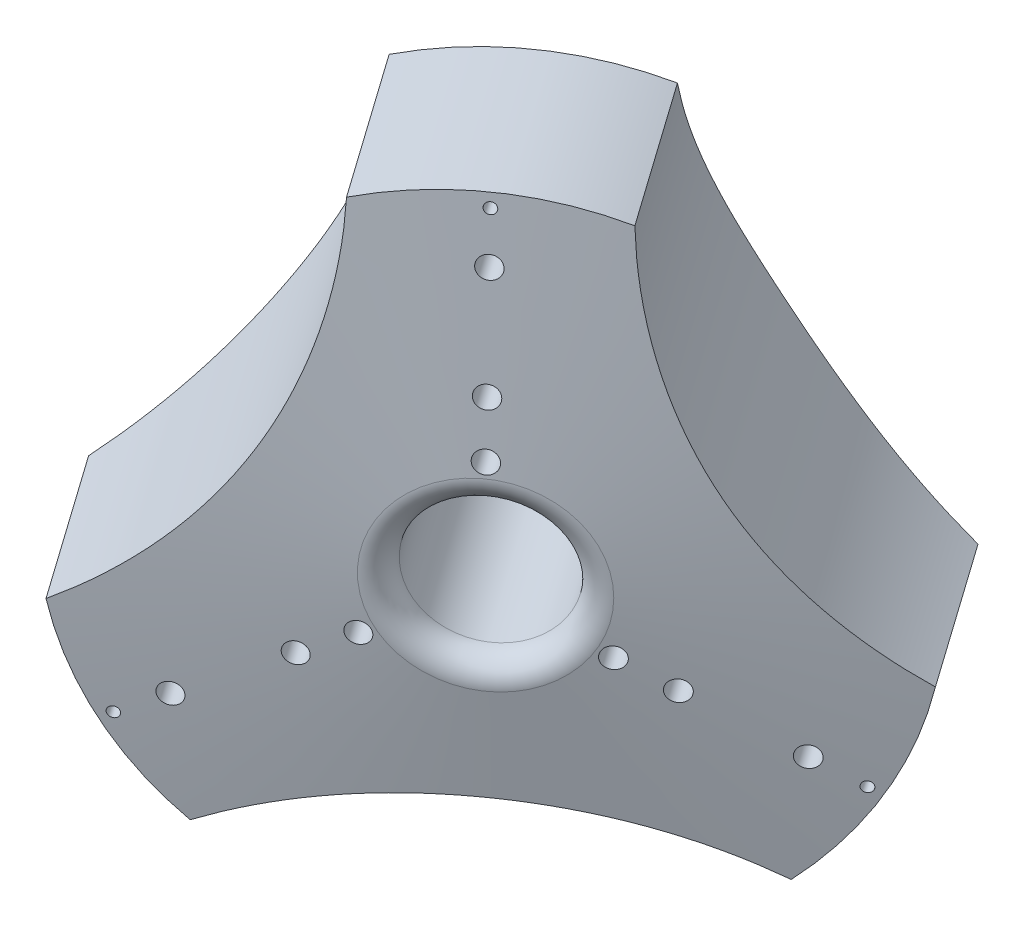
from build123d import *
from build123d.topology import SkipClean

# Parameters (mm, degrees)
CUT_EXTRUDE_START         = -62.125059625
CUT_EXTRUDE_1_OUTLINE_R   = 2
CUT_EXTRUDE_1_OUTLINE_R_2 = 1
CUT_EXTRUDE_1_OUTLINE_R_3 = 12.5
CUT_EXTRUDE_1_OUTLINE_R_4 = 10
CUT_EXTRUDE_1_DEPTH       = 62.125059625
FILLET_1_R                = 4.5
SHELL_1_T                 = 2
SKETCH_3_W                = 51.087463651
SKETCH_3_H                = 2.461244994
SKETCH_3_W_2              = 34.457429911
SKETCH_3_H_2              = 2.860365803
EXTRUDE_1_DEPTH           = 0.5
PATTERN_CIRCULAR_1_COUNT  = 3


# Read off the part's stored shape, not the designer's step: 旋转1, 切除-拉伸1
with BuildPart() as part:
    # 旋转1 outline → 旋转1 (revolve)
    with BuildSketch(Plane(origin=(99.94130942, 0, -70.573719517), x_dir=(0.8168642149223474, 0, -0.5768300047494903), z_dir=(0, -1, 0))):
        Polygon((10, 10.279561824), (10, -51.8454977), (61.61960751, -28.02437299), (61.61960751, 5.556476213), align=None)
    revolve(axis=Axis((99.94130942, 0, -70.573719517), (0.5768300047494903, 0, 0.8168642149223474)))

    # 切除-拉伸1 outline → 切除-拉伸1 (cut)
    # profile 1 of 16: a face of its own
    with BuildSketch(Plane(origin=(5.929559696, 0, 8.397006199), x_dir=(0.8168642149223475, 0, -0.5768300047494903), z_dir=(0.5768300047494903, 0, 0.8168642149223475)).offset(CUT_EXTRUDE_START)):
        with BuildLine():
            ThreePointArc((102.772124807, 58.427562009), (68.983372836, 30.809803909), (61.960068463, -12.26099267))
            ThreePointArc((61.960068463, -12.26099267), (91.170603939, 18.000000439), (102.772124807, 58.427562009))
        make_face()
    # profile 2 of 16: a face of its own
    with BuildSketch(Plane(origin=(5.929559696, 0, 8.397006199), x_dir=(0.8168642149223475, 0, -0.5768300047494903), z_dir=(0.5768300047494903, 0, 0.8168642149223475)).offset(CUT_EXTRUDE_START)):
        with BuildLine():
            ThreePointArc((163.159576322, -46.166570338), (122.34751937, -36), (81.535462149, -46.166569261))
            ThreePointArc((81.535462149, -46.166569261), (122.347518625, -61.61960751), (163.159576322, -46.166570338))
        make_face()
    # profile 3 of 16: a face of its own
    with BuildSketch(Plane(origin=(5.929559696, 0, 8.397006199), x_dir=(0.8168642149223475, 0, -0.5768300047494903), z_dir=(0.5768300047494903, 0, 0.8168642149223475)).offset(CUT_EXTRUDE_START)):
        with BuildLine():
            ThreePointArc((182.734967981, -12.26099267), (175.711663697, 30.809803755), (141.922911974, 58.427561896))
            ThreePointArc((141.922911974, 58.427561896), (153.524432758, 18), (182.734967981, -12.26099267))
        make_face()
    # profile 4 of 16: a face of its own
    with BuildSketch(Plane(origin=(5.929559696, 0, 8.397006199), x_dir=(0.8168642149223475, 0, -0.5768300047494903), z_dir=(0.5768300047494903, 0, 0.8168642149223475)).offset(CUT_EXTRUDE_START)):
        with Locations((122.347518222, 50)):
            Circle(CUT_EXTRUDE_1_OUTLINE_R)
    # profile 5 of 16: a face of its own
    with BuildSketch(Plane(origin=(5.929559696, 0, 8.397006199), x_dir=(0.8168642149223475, 0, -0.5768300047494903), z_dir=(0.5768300047494903, 0, 0.8168642149223475)).offset(CUT_EXTRUDE_START)):
        with Locations((71.148436256, -29.559803755)):
            Circle(CUT_EXTRUDE_1_OUTLINE_R_2)
    # profile 6 of 16: a face of its own
    with BuildSketch(Plane(origin=(5.929559696, 0, 8.397006199), x_dir=(0.8168642149223475, 0, -0.5768300047494903), z_dir=(0.5768300047494903, 0, 0.8168642149223475)).offset(CUT_EXTRUDE_START)):
        with Locations((79.046248032, -25)):
            Circle(CUT_EXTRUDE_1_OUTLINE_R)
    # profile 7 of 16: a face of its own
    with BuildSketch(Plane(origin=(5.929559696, 0, 8.397006199), x_dir=(0.8168642149223475, 0, -0.5768300047494903), z_dir=(0.5768300047494903, 0, 0.8168642149223475)).offset(CUT_EXTRUDE_START)):
        with Locations((96.366756108, -15)):
            Circle(CUT_EXTRUDE_1_OUTLINE_R)
    # profile 8 of 16: a face of its own
    with BuildSketch(Plane(origin=(5.929559696, 0, 8.397006199), x_dir=(0.8168642149223475, 0, -0.5768300047494903), z_dir=(0.5768300047494903, 0, 0.8168642149223475)).offset(CUT_EXTRUDE_START)):
        with Locations((122.347518222, 30)):
            Circle(CUT_EXTRUDE_1_OUTLINE_R)
    # profile 9 of 16: a face of its own
    with BuildSketch(Plane(origin=(5.929559696, 0, 8.397006199), x_dir=(0.8168642149223475, 0, -0.5768300047494903), z_dir=(0.5768300047494903, 0, 0.8168642149223475)).offset(CUT_EXTRUDE_START)):
        with Locations((122.347518222, 20)):
            Circle(CUT_EXTRUDE_1_OUTLINE_R)
    # profile 10 of 16: a face of its own
    with BuildSketch(Plane(origin=(5.929559696, 0, 8.397006199), x_dir=(0.8168642149223475, 0, -0.5768300047494903), z_dir=(0.5768300047494903, 0, 0.8168642149223475)).offset(CUT_EXTRUDE_START)):
        with Locations((122.347518222, 59.11960751)):
            Circle(CUT_EXTRUDE_1_OUTLINE_R_2)
    # profile 11 of 16: a face of its own
    with BuildSketch(Plane(origin=(5.929559696, 0, 8.397006199), x_dir=(0.8168642149223475, 0, -0.5768300047494903), z_dir=(0.5768300047494903, 0, 0.8168642149223475)).offset(CUT_EXTRUDE_START)):
        with Locations((173.546600187, -29.559803755)):
            Circle(CUT_EXTRUDE_1_OUTLINE_R_2)
    # profile 12 of 16: a face of its own
    with BuildSketch(Plane(origin=(5.929559696, 0, 8.397006199), x_dir=(0.8168642149223475, 0, -0.5768300047494903), z_dir=(0.5768300047494903, 0, 0.8168642149223475)).offset(CUT_EXTRUDE_START)):
        with Locations((122.347518222, 0)):
            Circle(CUT_EXTRUDE_1_OUTLINE_R_3)
        with Locations((122.347518222, 0)):
            Circle(CUT_EXTRUDE_1_OUTLINE_R_4, mode=Mode.SUBTRACT)
    # profile 13 of 16: a face of its own
    with BuildSketch(Plane(origin=(5.929559696, 0, 8.397006199), x_dir=(0.8168642149223475, 0, -0.5768300047494903), z_dir=(0.5768300047494903, 0, 0.8168642149223475)).offset(CUT_EXTRUDE_START)):
        with Locations((165.648788411, -25)):
            Circle(CUT_EXTRUDE_1_OUTLINE_R)
    # profile 14 of 16: a face of its own
    with BuildSketch(Plane(origin=(5.929559696, 0, 8.397006199), x_dir=(0.8168642149223475, 0, -0.5768300047494903), z_dir=(0.5768300047494903, 0, 0.8168642149223475)).offset(CUT_EXTRUDE_START)):
        with Locations((148.328280335, -15)):
            Circle(CUT_EXTRUDE_1_OUTLINE_R)
    # profile 15 of 16: a face of its own
    with BuildSketch(Plane(origin=(5.929559696, 0, 8.397006199), x_dir=(0.8168642149223475, 0, -0.5768300047494903), z_dir=(0.5768300047494903, 0, 0.8168642149223475)).offset(CUT_EXTRUDE_START)):
        with Locations((105.027010146, -10)):
            Circle(CUT_EXTRUDE_1_OUTLINE_R)
    # profile 16 of 16: a face of its own
    with BuildSketch(Plane(origin=(5.929559696, 0, 8.397006199), x_dir=(0.8168642149223475, 0, -0.5768300047494903), z_dir=(0.5768300047494903, 0, 0.8168642149223475)).offset(CUT_EXTRUDE_START)):
        with Locations((139.668026297, -10)):
            Circle(CUT_EXTRUDE_1_OUTLINE_R)
    extrude(amount=CUT_EXTRUDE_1_DEPTH, mode=Mode.SUBTRACT)

    # 圆角1
    fillet_1_edges = [part.edges().sort_by_distance(p)[0] for p in [
        (95.528119596, 0, -55.153191656),
    ]]
    fillet(fillet_1_edges, radius=FILLET_1_R)

    # 抽壳1 (no face opened: a closed hollow body)
    add(offset(amount=-SHELL_1_T, mode=Mode.PRIVATE), mode=Mode.SUBTRACT)

    # 草图3 → 凸台-拉伸1 (add, symmetric)
    with SkipClean():  # the faces are left unmerged after this step: merging them gives an invalid solid
        with BuildSketch(Plane(origin=(99.94130942, 0, -70.573719517), x_dir=(-0.5768300047494904, 0, -0.8168642149223474), z_dir=(0.8168642149223474, 0, -0.5768300047494904))):
            Polygon((-8.228062839, 16.477782917), (47.316249855, 16.477782917), (48.256723707, 14.052988626), (-8.228062839, 14.052988626), align=None)
            with Locations((17.980870337, 25.02562026)):
                Rectangle(SKETCH_3_W, SKETCH_3_H)
            with Locations((12.587710185, 55.122147048)):
                Rectangle(SKETCH_3_W_2, SKETCH_3_H_2)
        extrude_1 = extrude(amount=EXTRUDE_1_DEPTH, both=True)
    add(part.part.scale(1), mode=Mode.REPLACE)  # the faces are merged on a copy

    # 阵列(圆周)1: 凸台-拉伸1 ×3 about axis
    with SkipClean():  # the faces are left unmerged after this step: merging them gives an invalid solid
        pattern_circular_1_axis = Axis((99.94130942, 0, -70.573719517), (0.5768300047494903, 0, 0.8168642149223474))
        for i in range(1, PATTERN_CIRCULAR_1_COUNT):
            add(extrude_1.rotate(pattern_circular_1_axis, i * 360 / PATTERN_CIRCULAR_1_COUNT))
    add(part.part.scale(1), mode=Mode.REPLACE)  # the faces are merged on a copy


solid = part.part
